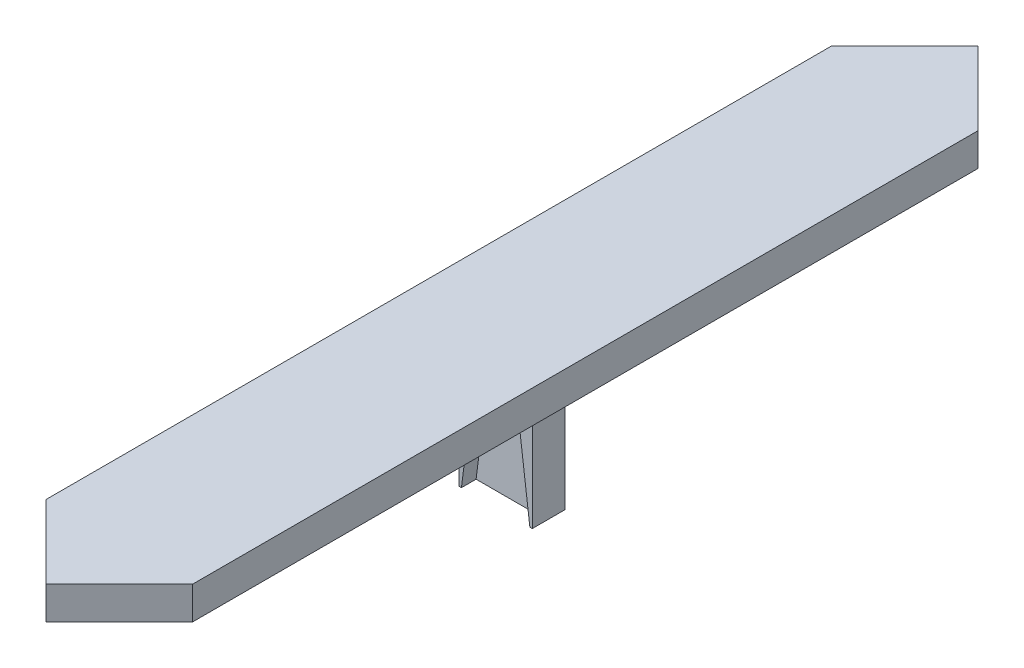
from build123d import *

# Parameters (mm, degrees)
BOSS_EXTRUDE1_DEPTH = 3.125
SKETCH2_W           = 7
SKETCH2_H           = 3.125
BOSS_EXTRUDE2_DEPTH = 12
CUT_EXTRUDE1_DEPTH  = 1.4


with BuildPart() as part:
    # Sketch1 → Boss-Extrude1 (new body)
    with BuildSketch(Plane(origin=(0, 0, 0), x_dir=(1, 0, 0), z_dir=(0, 1, 0))):
        Polygon((0, 0), (7, -7), (7, -82), (0, -89), (-7, -82), (-7, -7), align=None)
    extrude(amount=BOSS_EXTRUDE1_DEPTH)

    # Sketch2 → Boss-Extrude2 (add)
    with BuildSketch(Plane.XZ):
        with Locations((0, 44.5)):
            Rectangle(SKETCH2_W, SKETCH2_H)
    extrude(amount=BOSS_EXTRUDE2_DEPTH)

    # Sketch3 → Cut-Extrude1 (cut)
    with BuildSketch(Plane.XY.offset(46.0625)):
        with BuildLine():
            Line((3.5, -13.84), (-3.5, -13.84))
            Line((-3.5, -13.84), (-2, -2))
            ThreePointArc((-2, -2), (0, 0), (2, -2))
            Line((2, -2), (3.5, -13.84))
        make_face()
    extrude(amount=-CUT_EXTRUDE1_DEPTH, mode=Mode.SUBTRACT)


solid = part.part
